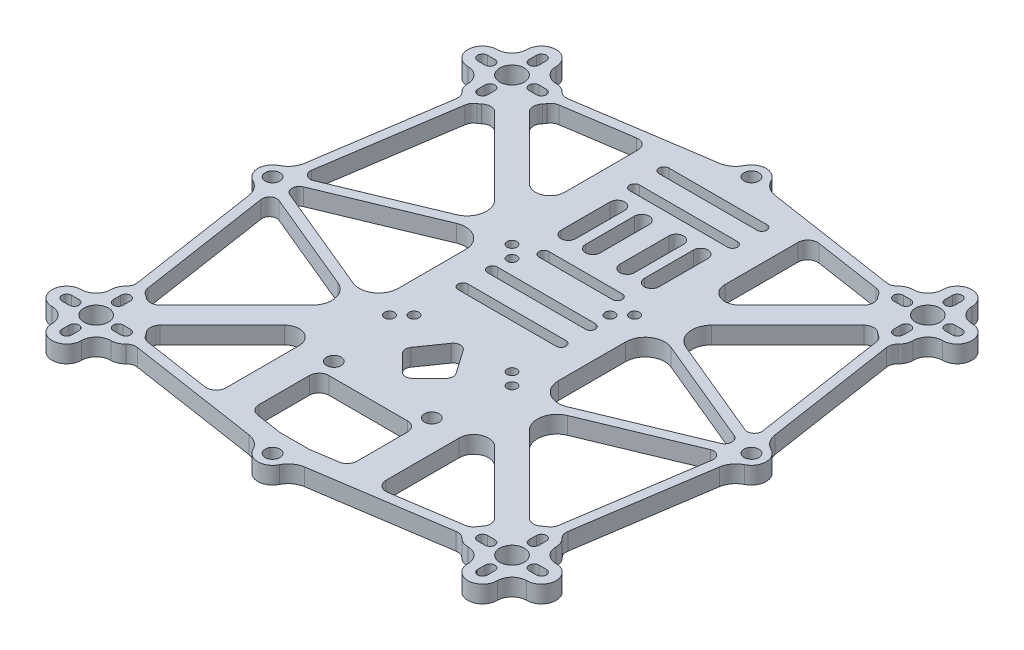
from build123d import *

# Parameters (mm, degrees)
SKETCH_1_R      = 1.5
SKETCH_1_R_2    = 1
SKETCH_1_R_3    = 2.5
EXTRUDE_1_DEPTH = 3.5
FILLET_1_R      = 2
FILLET_2_R      = 4
FILLET_3_R      = 3
FILLET_5_R      = 1.5


with BuildPart() as part:
    # 草图1 → 凸台-拉伸1 (new body)
    with BuildSketch(Plane(origin=(0, 0, 0), x_dir=(1, 0, 0), z_dir=(0, 1, 0))):
        with BuildLine():
            ThreePointArc((43.743516462, 33.730999235), (44.971139546, 34.837591081), (45.426406871, 36.426406871))
            Line((45.426406871, 36.426406871), (45.426406871, 39.426406871))
            Line((45.426406871, 39.426406871), (48.426406871, 39.426406871))
            ThreePointArc((48.426406871, 39.426406871), (51.426406871, 42.426406871), (48.426406871, 45.426406871))
            Line((48.426406871, 45.426406871), (45.426406871, 45.426406871))
            Line((45.426406871, 45.426406871), (45.426406871, 48.426406871))
            ThreePointArc((45.426406871, 48.426406871), (42.426406871, 51.426406871), (39.426406871, 48.426406871))
            Line((39.426406871, 48.426406871), (39.426406871, 45.426406871))
            Line((39.426406871, 45.426406871), (36.426406871, 45.426406871))
            ThreePointArc((36.426406871, 45.426406871), (34.837591081, 44.971139546), (33.730999235, 43.743516462))
            Line((33.730999235, 43.743516462), (2.966165528, 48.403523125))
            ThreePointArc((2.966165528, 48.403523125), (2.274628745, 50.808846481), (0, 51.852813742))
            Line((0, 51.852813742), (0, 50.352813742))
            ThreePointArc((0, 50.352813742), (1.5, 48.852813742), (0, 47.352813742))
            Line((0, 47.352813742), (0, 42))
            Line((0, 42), (10, 42))
            ThreePointArc((10, 42), (11, 41), (10, 40))
            Line((10, 40), (0, 40))
            Line((0, 40), (0, 36))
            Line((0, 36), (10, 36))
            ThreePointArc((10, 36), (11, 35), (10, 34))
            Line((10, 34), (0, 34))
            Line((0, 34), (0, 15))
            Line((0, 15), (7.5, 15))
            ThreePointArc((7.5, 15), (8.5, 14), (7.5, 13))
            Line((7.5, 13), (0, 13))
            Line((0, 13), (0, 7))
            Line((0, 7), (10, 7))
            ThreePointArc((10, 7), (11, 6), (10, 5))
            Line((10, 5), (0, 5))
            Line((0, 5), (0, 1))
            Line((0, 1), (10, 1))
            ThreePointArc((10, 1), (11, 0), (10, -1))
            Line((10, -1), (0, -1))
            Line((0, -1), (0, -9.433792539))
            Line((0, -9.433792539), (5.324488288, -17.037949874))
            Line((5.324488288, -17.037949874), (0, -22.362438162))
            Line((0, -22.362438162), (0, -29.352813742))
            Line((0, -29.352813742), (10, -29.352813742))
            Line((10, -29.352813742), (10, -43.352813742))
            Line((10, -43.352813742), (2.999961644, -44.41312259))
            Line((2.999961644, -44.41312259), (0, -44.41312259))
            Line((0, -44.41312259), (0, -47.352813742))
            ThreePointArc((0, -47.352813742), (1.5, -48.852813742), (0, -50.352813742))
            Line((0, -50.352813742), (0, -51.852813742))
            ThreePointArc((0, -51.852813742), (2.274628745, -50.808846481), (2.966165528, -48.403523125))
            Line((2.966165528, -48.403523125), (33.730999235, -43.743516462))
            ThreePointArc((33.730999235, -43.743516462), (34.837591081, -44.971139546), (36.426406871, -45.426406871))
            Line((36.426406871, -45.426406871), (39.426406871, -45.426406871))
            Line((39.426406871, -45.426406871), (39.426406871, -48.426406871))
            ThreePointArc((39.426406871, -48.426406871), (42.426406871, -51.426406871), (45.426406871, -48.426406871))
            Line((45.426406871, -48.426406871), (45.426406871, -45.426406871))
            Line((45.426406871, -45.426406871), (48.426406871, -45.426406871))
            ThreePointArc((48.426406871, -45.426406871), (51.426406871, -42.426406871), (48.426406871, -39.426406871))
            Line((48.426406871, -39.426406871), (45.426406871, -39.426406871))
            Line((45.426406871, -39.426406871), (45.426406871, -36.426406871))
            ThreePointArc((45.426406871, -36.426406871), (44.971139546, -34.837591081), (43.743516462, -33.730999235))
            Line((43.743516462, -33.730999235), (48.403523125, -2.966165528))
            ThreePointArc((48.403523125, -2.966165528), (51.852813742, 0), (48.403523125, 2.966165528))
            Line((48.403523125, 2.966165528), (43.743516462, 33.730999235))
        make_face()
        with Locations(Location((10, -26.352813742, 0), (0, 0, 270))):
            Circle(SKETCH_1_R, mode=Mode.SUBTRACT)
        with Locations(Location((10, -10, 0), (0, 0, 270))):
            Circle(SKETCH_1_R_2, mode=Mode.SUBTRACT)
        with Locations(Location((12.5, -12.5, 0), (0, 0, 270))):
            Circle(SKETCH_1_R_2, mode=Mode.SUBTRACT)
        with BuildLine():
            ThreePointArc((36.426406871, -43.426406871), (35.426406871, -42.426406871), (36.426406871, -41.426406871))
            Line((36.426406871, -41.426406871), (37.926406871, -41.426406871))
            ThreePointArc((37.926406871, -41.426406871), (38.926406871, -42.426406871), (37.926406871, -43.426406871))
            Line((37.926406871, -43.426406871), (36.426406871, -43.426406871))
        make_face(mode=Mode.SUBTRACT)
        with BuildLine():
            Line((33.502428597, -41.755324872), (16.328427125, -44.356702863))
            Line((16.328427125, -44.356702863), (16.328427125, -19.863961031))
            Line((16.328427125, -19.863961031), (35.931908405, -39.467442311))
            ThreePointArc((35.931908405, -39.467442311), (34.632584926, -40.021785731), (33.730999235, -41.109297281))
            ThreePointArc((33.730999235, -41.109297281), (33.59820737, -41.425763287), (33.502428597, -41.755324872))
        make_face(mode=Mode.SUBTRACT)
        with BuildLine():
            Line((43.426406871, -46.926406871), (43.426406871, -48.426406871))
            ThreePointArc((43.426406871, -48.426406871), (42.426406871, -49.426406871), (41.426406871, -48.426406871))
            Line((41.426406871, -48.426406871), (41.426406871, -46.926406871))
            ThreePointArc((41.426406871, -46.926406871), (42.426406871, -45.926406871), (43.426406871, -46.926406871))
        make_face(mode=Mode.SUBTRACT)
        with Locations(Location((42.426406871, -42.426406871, 0), (0, 0, 270))):
            Circle(SKETCH_1_R_3, mode=Mode.SUBTRACT)
        with BuildLine():
            ThreePointArc((48.426406871, -41.426406871), (49.426406871, -42.426406871), (48.426406871, -43.426406871))
            Line((48.426406871, -43.426406871), (46.926406871, -43.426406871))
            ThreePointArc((46.926406871, -43.426406871), (45.926406871, -42.426406871), (46.926406871, -41.426406871))
            Line((46.926406871, -41.426406871), (48.426406871, -41.426406871))
        make_face(mode=Mode.SUBTRACT)
        with BuildLine():
            Line((41.426406871, -37.926406871), (41.426406871, -36.426406871))
            ThreePointArc((41.426406871, -36.426406871), (42.426406871, -35.426406871), (43.426406871, -36.426406871))
            Line((43.426406871, -36.426406871), (43.426406871, -37.926406871))
            ThreePointArc((43.426406871, -37.926406871), (42.426406871, -38.926406871), (41.426406871, -37.926406871))
        make_face(mode=Mode.SUBTRACT)
        with BuildLine():
            Line((46.449283009, -2.513451126), (41.755324872, -33.502428597))
            ThreePointArc((41.755324872, -33.502428597), (40.242396216, -34.369686798), (39.467442311, -35.931908405))
            Line((39.467442311, -35.931908405), (17.899311843, -14.363777937))
            Line((17.899311843, -14.363777937), (46.449283009, -2.513451126))
        make_face(mode=Mode.SUBTRACT)
        Polygon((16.328427125, -12.850367132), (16.328427125, 12.850367132), (47.287709257, 0), align=None, mode=Mode.SUBTRACT)
        with Locations(Location((10, 10, 0), (0, 0, 270))):
            Circle(SKETCH_1_R_2, mode=Mode.SUBTRACT)
        with Locations(Location((12.5, 12.5, 0), (0, 0, 270))):
            Circle(SKETCH_1_R_2, mode=Mode.SUBTRACT)
        with BuildLine():
            ThreePointArc((2, 30), (3.5, 31.5), (5, 30))
            Line((5, 30), (5, 20))
            ThreePointArc((5, 20), (3.5, 18.5), (2, 20))
            Line((2, 20), (2, 30))
        make_face(mode=Mode.SUBTRACT)
        with BuildLine():
            ThreePointArc((7, 30), (8.5, 31.5), (10, 30))
            Line((10, 30), (10, 20))
            ThreePointArc((10, 20), (8.5, 18.5), (7, 20))
            Line((7, 20), (7, 30))
        make_face(mode=Mode.SUBTRACT)
        with BuildLine():
            ThreePointArc((39.467442311, 35.931908405), (40.242396216, 34.369686798), (41.755324872, 33.502428597))
            Line((41.755324872, 33.502428597), (46.449283009, 2.513451126))
            Line((46.449283009, 2.513451126), (17.899311843, 14.363777937))
            Line((17.899311843, 14.363777937), (39.467442311, 35.931908405))
        make_face(mode=Mode.SUBTRACT)
        with Locations(Location((48.852813742, 0, 0), (0, 0, 270))):
            Circle(SKETCH_1_R, mode=Mode.SUBTRACT)
        with BuildLine():
            Line((16.328427125, 19.863961031), (16.328427125, 44.356702863))
            Line((16.328427125, 44.356702863), (33.502428597, 41.755324872))
            ThreePointArc((33.502428597, 41.755324872), (34.369686798, 40.242396216), (35.931908405, 39.467442311))
            Line((35.931908405, 39.467442311), (16.328427125, 19.863961031))
        make_face(mode=Mode.SUBTRACT)
        with BuildLine():
            Line((37.926406871, 41.426406871), (36.426406871, 41.426406871))
            ThreePointArc((36.426406871, 41.426406871), (35.426406871, 42.426406871), (36.426406871, 43.426406871))
            Line((36.426406871, 43.426406871), (37.926406871, 43.426406871))
            ThreePointArc((37.926406871, 43.426406871), (38.926406871, 42.426406871), (37.926406871, 41.426406871))
        make_face(mode=Mode.SUBTRACT)
        with BuildLine():
            ThreePointArc((43.426406871, 36.426406871), (42.426406871, 35.426406871), (41.426406871, 36.426406871))
            Line((41.426406871, 36.426406871), (41.426406871, 37.926406871))
            ThreePointArc((41.426406871, 37.926406871), (42.426406871, 38.926406871), (43.426406871, 37.926406871))
            Line((43.426406871, 37.926406871), (43.426406871, 36.426406871))
        make_face(mode=Mode.SUBTRACT)
        with Locations(Location((42.426406871, 42.426406871, 0), (0, 0, 270))):
            Circle(SKETCH_1_R_3, mode=Mode.SUBTRACT)
        with BuildLine():
            ThreePointArc((41.426406871, 48.426406871), (42.426406871, 49.426406871), (43.426406871, 48.426406871))
            Line((43.426406871, 48.426406871), (43.426406871, 46.926406871))
            ThreePointArc((43.426406871, 46.926406871), (42.426406871, 45.926406871), (41.426406871, 46.926406871))
            Line((41.426406871, 46.926406871), (41.426406871, 48.426406871))
        make_face(mode=Mode.SUBTRACT)
        with BuildLine():
            Line((46.926406871, 43.426406871), (48.426406871, 43.426406871))
            ThreePointArc((48.426406871, 43.426406871), (49.426406871, 42.426406871), (48.426406871, 41.426406871))
            Line((48.426406871, 41.426406871), (46.926406871, 41.426406871))
            ThreePointArc((46.926406871, 41.426406871), (45.926406871, 42.426406871), (46.926406871, 43.426406871))
        make_face(mode=Mode.SUBTRACT)
    extrude(amount=EXTRUDE_1_DEPTH)

    # 圆角1
    fillet_1_edges = [part.edges().sort_by_distance(p)[0] for p in [
        (41.755324872, 1.75, -33.502428597),
        (39.467442311, 1.75, -35.931908405),
        (16.328427125, 1.75, -44.356702863),
        (35.931908405, 1.75, -39.467442311),
        (33.502428597, 1.75, -41.755324872),
        (41.755324872, 1.75, 33.502428597),
        (39.467442311, 1.75, 35.931908405),
        (35.931908405, 1.75, 39.467442311),
        (16.328427125, 1.75, 44.356702863),
        (33.502428597, 1.75, 41.755324872),
        (2.999961644, 1.75, 44.41312259),
        (10, 1.75, 43.352813742),
        (10, 1.75, 29.352813742),
        (33.730999235, 1.75, -43.743516462),
        (43.743516462, 1.75, -33.730999235),
        (43.743516462, 1.75, 33.730999235),
        (33.730999235, 1.75, 43.743516462),
    ]]
    fillet(fillet_1_edges, radius=FILLET_1_R)

    # 圆角2
    fillet_2_edges = [part.edges().sort_by_distance(p)[0] for p in [
        (16.328427125, 1.75, -12.850367132),
        (16.328427125, 1.75, 12.850367132),
        (17.899311843, 1.75, -14.363777937),
        (17.899311843, 1.75, 14.363777937),
        (2.966165528, 1.75, 48.403523125),
        (2.966165528, 1.75, -48.403523125),
        (48.403523125, 1.75, -2.966165528),
        (48.403523125, 1.75, 2.966165528),
    ]]
    fillet(fillet_2_edges, radius=FILLET_2_R)

    # 圆角3
    fillet_3_edges = [part.edges().sort_by_distance(p)[0] for p in [
        (39.426406871, 1.75, 45.426406871),
        (45.426406871, 1.75, 39.426406871),
        (45.426406871, 1.75, 45.426406871),
        (39.426406871, 1.75, -45.426406871),
        (45.426406871, 1.75, -45.426406871),
        (45.426406871, 1.75, -39.426406871),
        (16.328427125, 1.75, -19.863961031),
        (16.328427125, 1.75, 19.863961031),
    ]]
    fillet(fillet_3_edges, radius=FILLET_3_R - 0.0001)  # a hair under: the kernel refuses the full size

    # 镜向1: part across plane


with BuildPart() as part_1:
    add(part.part)
    add(part.part.mirror(Plane(origin=(0, 3.5, 0), x_dir=(0, 0, 1), z_dir=(-1, 0, 0))))

    # 圆角5
    fillet_5_edges = [part_1.edges().sort_by_distance(p)[0] for p in [
        (47.287709257, 1.75, 0),
        (46.449283009, 1.75, -2.513451126),
        (46.449283009, 1.75, 2.513451126),
        (5.324488288, 1.75, 17.037949874),
        (-47.287709257, 1.75, 0),
        (-46.449283009, 1.75, -2.513451126),
        (-46.449283009, 1.75, 2.513451126),
        (0, 1.75, 9.433792539),
        (-5.324488288, 1.75, 17.037949874),
        (0, 1.75, 22.362438162),
    ]]
    fillet(fillet_5_edges, radius=FILLET_5_R)


solid = part_1.part
